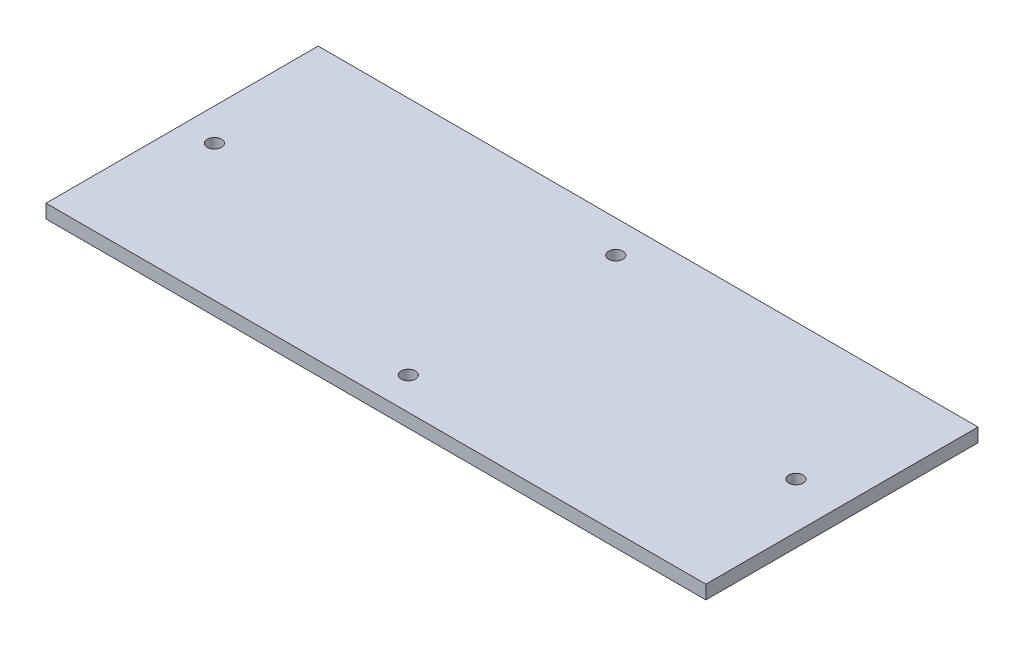
from build123d import *

# Parameters (mm, degrees)
SKETCH1_W           = 153.175
SKETCH1_H           = 63.175
SKETCH1_R           = 1.65
BOSS_EXTRUDE1_DEPTH = 3.175


with BuildPart() as part:
    # Sketch1 → Boss-Extrude1 (new body)
    with BuildSketch(Plane(origin=(0, 0, 0), x_dir=(1, 0, 0), z_dir=(0, 1, 0))):
        Rectangle(SKETCH1_W, SKETCH1_H)
        with Locations((0, 24.0875)):
            Circle(SKETCH1_R, mode=Mode.SUBTRACT)
        with Locations((-69.0875, 0)):
            Circle(SKETCH1_R, mode=Mode.SUBTRACT)
        with Locations((65.9125, 0)):
            Circle(SKETCH1_R, mode=Mode.SUBTRACT)
        with Locations((0, -24.0875)):
            Circle(SKETCH1_R, mode=Mode.SUBTRACT)
    extrude(amount=BOSS_EXTRUDE1_DEPTH)


solid = part.part
